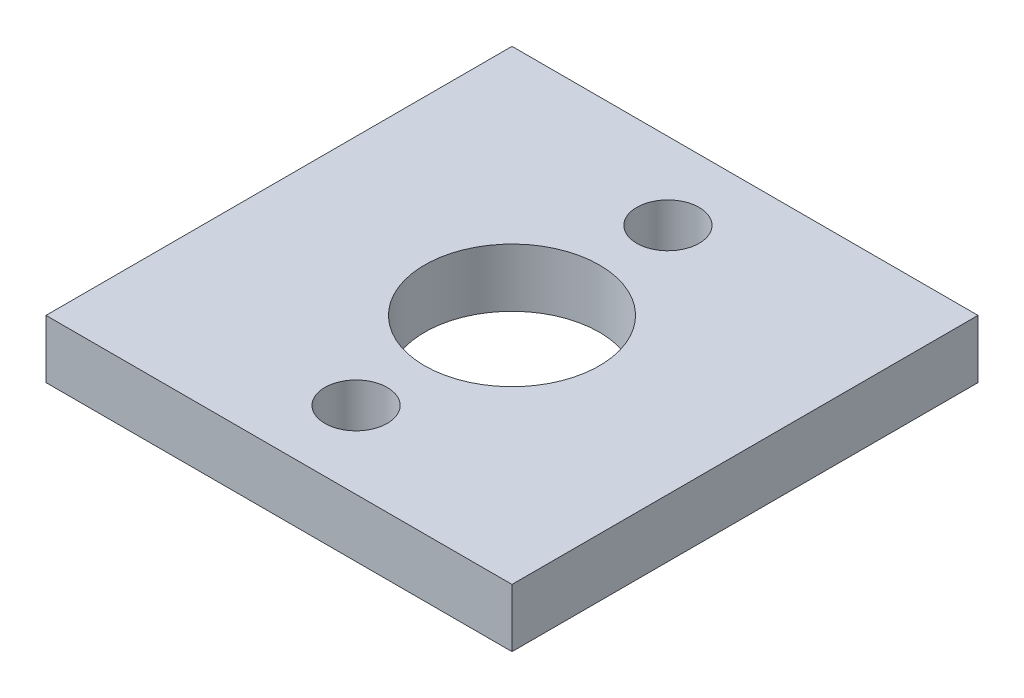
from build123d import *

# Parameters (mm, degrees)
SKETCH2_W            = 25.4
SKETCH2_H            = 25.4
BOSS_EXTRUDE1_DEPTH  = 3.175
SKETCH4_R            = 4.7625
CUT_EXTRUDE1_DEPTH   = 19.238986403
M3_CLEARANCE_HOLE2_D = 3.4


with BuildPart() as part:
    # Sketch2 → Boss-Extrude1 (new body)
    with BuildSketch(Plane(origin=(0, 0, 0), x_dir=(1, 0, 0), z_dir=(0, 1, 0))):
        Rectangle(SKETCH2_W, SKETCH2_H)
    extrude(amount=BOSS_EXTRUDE1_DEPTH)

    # Sketch4 → Cut-Extrude1 (cut, through all)
    with BuildSketch(Plane(origin=(0, 3.175, 0), x_dir=(1, 0, 0), z_dir=(0, 1, 0))):
        Circle(SKETCH4_R)
    extrude(amount=-CUT_EXTRUDE1_DEPTH, mode=Mode.SUBTRACT)

    # M3 Clearance Hole2 (through all)
    with Locations(Plane(origin=(0, 3.175, -8.5), x_dir=(0, 0, 1), z_dir=(0, 1, 0))):
        with Locations((0, 0), (17, 0)):
            Hole(M3_CLEARANCE_HOLE2_D / 2)


solid = part.part
